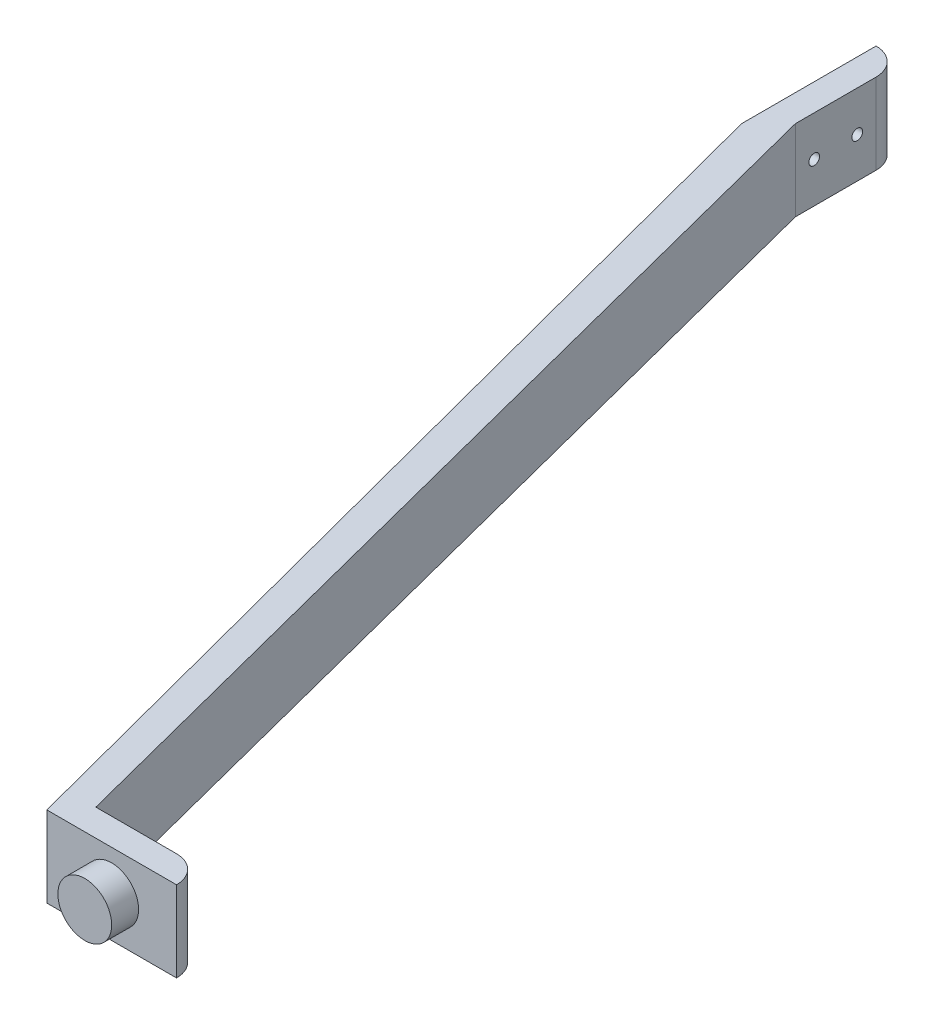
from build123d import *

# Parameters (mm, degrees)
ESQUISSE1_W             = 140
ESQUISSE1_H             = 400
BOSS_EXTRU_1_DEPTH      = 30
ENL_V_MAT_EXTRU_2_DEPTH = 30
ESQUISSE3_R             = 2
ENL_V_MAT_EXTRU_3_DEPTH = 246.967477525
BOSS_EXTRU_3_DEPTH      = 10
CONG_1_R                = 10
CONG_2_R                = 10


with BuildPart() as part:
    # Esquisse1 → Boss.-Extru.1 (new body)
    with BuildSketch(Plane(origin=(0, 0, 0), x_dir=(1, 0, 0), z_dir=(0, 1, 0))):
        Rectangle(ESQUISSE1_W, ESQUISSE1_H)
    extrude(amount=BOSS_EXTRU_1_DEPTH)

    # Esquisse2 → Enlèv. mat.-Extru.2 (cut)
    with BuildSketch(Plane(origin=(0, 30, 0), x_dir=(1, 0, 0), z_dir=(0, 1, 0))):
        Polygon((21.786415215, -200), (-70, 150), (-70, -200), align=None)
        Polygon((70, 200), (-60, 200), (-60, 160), (30, -190), (70, -190), align=None)
    extrude(amount=-ENL_V_MAT_EXTRU_2_DEPTH, mode=Mode.SUBTRACT)

    # Esquisse3 → Enlèv. mat.-Extru.3 (cut, through all)
    with BuildSketch(Plane.ZY.offset(70)):
        with Locations((-183, 15)):
            Circle(ESQUISSE3_R)
        with Locations((-167, 15)):
            Circle(ESQUISSE3_R)
    extrude(amount=-ENL_V_MAT_EXTRU_3_DEPTH, mode=Mode.SUBTRACT)

    # Esquisse4 → Boss.-Extru.3 (add)
    with BuildSketch(Plane.XY.offset(200)):
        with BuildLine():
            ThreePointArc((55.893207608, 15), (48.640450238, 24.615230519), (37.402676021, 20.283074236))
            Line((37.402676021, 20.283074236), (54.383739194, 9.716925764))
            ThreePointArc((54.383739194, 9.716925764), (55.508438127, 12.25275737), (55.893207608, 15))
        make_face()
        with BuildLine():
            Line((54.383739194, 9.716925764), (37.402676021, 20.283074236))
            ThreePointArc((37.402676021, 20.283074236), (40.610133372, 6.509468414), (54.383739194, 9.716925764))
        make_face()
    extrude(amount=BOSS_EXTRU_3_DEPTH)

    # Congé1
    cong_1_edges = [part.edges().sort_by_distance(p)[0] for p in [
        (-60, 15, -200),
    ]]
    fillet(cong_1_edges, radius=CONG_1_R - 0.0001)  # a hair under: the kernel refuses the full size

    # Congé2
    cong_2_edges = [part.edges().sort_by_distance(p)[0] for p in [
        (70, 15, 190),
    ]]
    fillet(cong_2_edges, radius=CONG_2_R - 0.0001)  # a hair under: the kernel refuses the full size


solid = part.part
